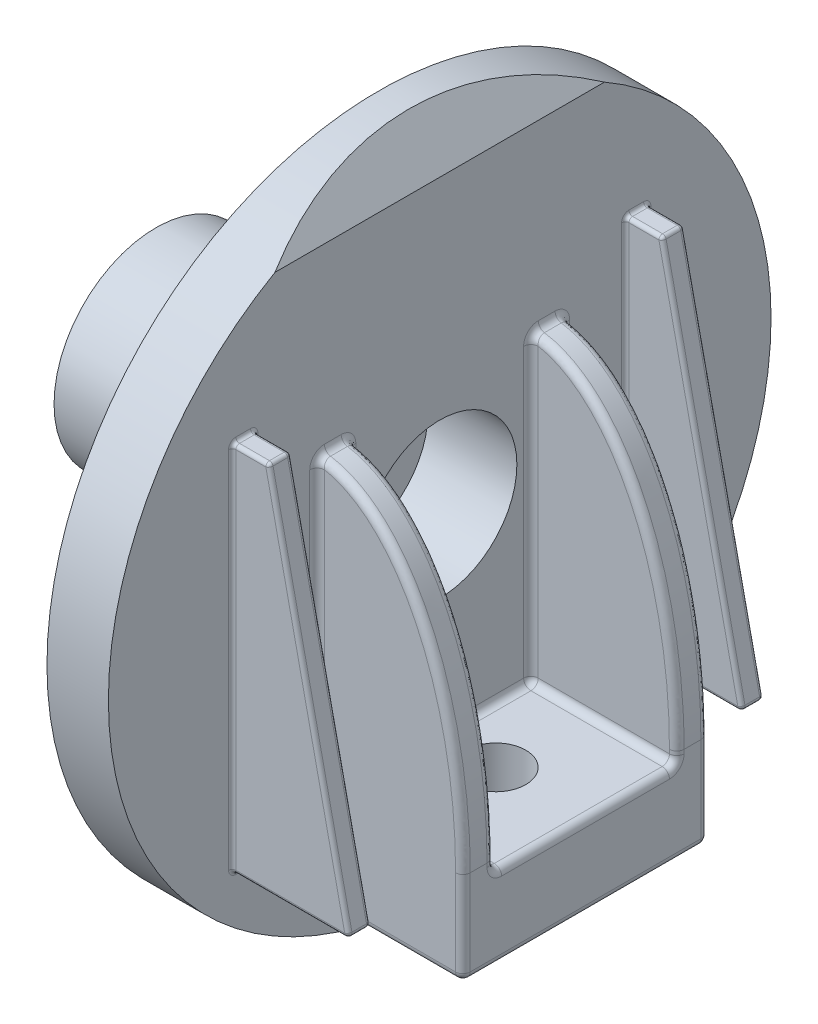
from build123d import *

# Parameters (mm, degrees)
SKETCH1_R               = 22.65
BOSS_EXTRUDE1_DEPTH     = 4.2
SKETCH2_R               = 20.05
CUT_EXTRUDE1_DEPTH      = 2.25
FILLET1_R               = 0.3
SKETCH4_R               = 6.965
BOSS_EXTRUDE3_DEPTH     = 17.45
FILLET2_R               = 1.5
SKETCH5_R               = 4.875
CUT_EXTRUDE3_DEPTH      = 12.26
SKETCH3_R               = 2.625
CUT_EXTRUDE2_DEPTH      = 11.25
SKETCH6_R               = 5.275
CUT_EXTRUDE5_DEPTH      = 6.08
BOSS_EXTRUDE4_START     = 12.26
BOSS_EXTRUDE4_DEPTH     = 12.26
BOSS_EXTRUDE5_DEPTH     = 9.97
FILLET3_START           = -8.385
FILLET3_DEPTH           = 16.77
SKETCH9_R               = 2.045
CUT_EXTRUDE6_DEPTH      = 9.97
FILLET4_R               = 0.5
CUT_EXTRUDE7_DEPTH      = 19.97
CUT_EXTRUDE7_DEPTH_BACK = 19.97
BOSS_EXTRUDE6_START     = 17.63
BOSS_EXTRUDE6_DEPTH     = 17.63
SKETCH12_W              = 1.5
SKETCH12_H              = 25.4
BOSS_EXTRUDE7_DEPTH     = 8
CUT_EXTRUDE8_DEPTH      = 4
FILLET5_R               = 0.25


with BuildPart() as part:
    # Sketch1 → Boss-Extrude1 (new body)
    with BuildSketch(Plane(origin=(0, 0, 0), x_dir=(0, 0, -1), z_dir=(1, 0, 0))):
        Circle(SKETCH1_R)
    extrude(amount=BOSS_EXTRUDE1_DEPTH)

    # Sketch2 → Cut-Extrude1 (cut)
    with BuildSketch(Plane.ZY):
        Circle(SKETCH2_R)
    extrude(amount=-CUT_EXTRUDE1_DEPTH, mode=Mode.SUBTRACT)

    # Fillet1
    fillet1_edges = [part.edges().sort_by_distance(p)[0] for p in [
        (2.25, 0, -20.05),
        (0, 0, -20.05),
    ]]
    fillet(fillet1_edges, radius=FILLET1_R)

    # Sketch4 → Boss-Extrude3 (add)
    with BuildSketch(Plane.ZY.offset(-2.25)):
        Circle(SKETCH4_R)
    extrude(amount=BOSS_EXTRUDE3_DEPTH)

    # Fillet2
    fillet2_edges = [part.edges().sort_by_distance(p)[0] for p in [
        (2.25, 0, -6.965),
    ]]
    fillet(fillet2_edges, radius=FILLET2_R)

    # Sketch5 → Cut-Extrude3 (cut)
    with BuildSketch(Plane.ZY.offset(15.2)):
        Circle(SKETCH5_R)
    extrude(amount=-CUT_EXTRUDE3_DEPTH, mode=Mode.SUBTRACT)

    # Sketch3 → Cut-Extrude2 (cut)
    with BuildSketch(Plane(origin=(4.2, 0, 0), x_dir=(0, 0, -1), z_dir=(1, 0, 0))):
        Circle(SKETCH3_R)
    extrude(amount=-CUT_EXTRUDE2_DEPTH, mode=Mode.SUBTRACT)

    # Sketch6 → Cut-Extrude5 (cut)
    with BuildSketch(Plane(origin=(4.2, 0, 0), x_dir=(0, 0, -1), z_dir=(1, 0, 0))):
        Circle(SKETCH6_R)
    extrude(amount=-CUT_EXTRUDE5_DEPTH, mode=Mode.SUBTRACT)

    # Sketch7 → Boss-Extrude4 (add)
    with BuildSketch(Plane.ZY.offset(2.94).offset(BOSS_EXTRUDE4_START)):
        with BuildLine():
            Line((-2.69098495, -4.065), (2.69098495, -4.065))
            ThreePointArc((2.69098495, -4.065), (0, -4.875), (-2.69098495, -4.065))
        make_face()
        with BuildLine():
            Line((2.69098495, 4.065), (-2.69098495, 4.065))
            ThreePointArc((-2.69098495, 4.065), (0, 4.875), (2.69098495, 4.065))
        make_face()
    extrude(amount=-BOSS_EXTRUDE4_DEPTH)

    # Sketch8 → Boss-Extrude5 (add)
    with BuildSketch(Plane(origin=(4.2, 0, 0), x_dir=(0, 0, -1), z_dir=(1, 0, 0))):
        Polygon((8.385, -18.97), (-8.385, -18.97), (-8.385, 7.34), (-6.235, 7.34), (-6.235, -13.37), (6.235, -13.37), (6.235, 7.34), (8.385, 7.34), align=None)
    extrude(amount=BOSS_EXTRUDE5_DEPTH)

    # Fillet3: read off the stored shape, not the designer's step
    # Fillet3 outline → Fillet3 (cut)
    with BuildSketch(Plane.XY.offset(FILLET3_START)):
        with BuildLine():
            Line((14.17, 7.34), (4.2, 7.34))
            add(Edge.make_bspline(
                [(4.2, 7.34), (14.17, 6.575053386), (14.17, -12.601391626)],
                knots=[0, 0, 0, 1, 1, 1], degree=2, weights=[1, 0.733655232, 1]))
            Line((14.17, -12.601391626), (14.17, 7.34))
        make_face()
    extrude(amount=FILLET3_DEPTH, mode=Mode.SUBTRACT)

    # Sketch9 → Cut-Extrude6 (cut)
    with BuildSketch(Plane.XZ.offset(18.97)):
        with Locations(Location((8.035, 0, 0), (0, 0, 270))):
            Circle(SKETCH9_R)
    extrude(amount=-CUT_EXTRUDE6_DEPTH, mode=Mode.SUBTRACT)

    # Fillet4
    fillet4_edges = [part.edges().sort_by_distance(p)[0] for p in [
        (4.2, 7.34, -7.31),
        (4.2, -18.97, 0),
        (4.2, 7.34, 7.31),
        (9.185, -13.37, 6.235),
        (12.196725877, -0.808020122, 6.235),
        (4.2, -3.015, 6.235),
        (9.185, -13.37, -6.235),
        (4.2, -3.015, -6.235),
        (12.196725877, -0.808020122, -6.235),
        (9.185, -18.97, -8.385),
        (12.196714654, -0.807990396, -8.385),
        (4.2, -5.815, -8.385),
        (9.185, -18.97, 8.385),
        (4.2, -5.815, 8.385),
        (12.196714654, -0.807990396, 8.385),
        (14.17, -18.97, 0),
        (14.17, -15.785695813, 8.385),
        (14.17, -12.985695813, 6.235),
        (14.17, -13.37, 0),
        (14.17, -12.985695813, -6.235),
        (14.17, -15.785695813, -8.385),
        (4.2, -13.37, 0),
    ]]
    fillet(fillet4_edges, radius=FILLET4_R)

    # Sketch10 → Cut-Extrude7 (cut, two sides: drawn at the far end of the back side and taken through both)
    with BuildSketch(Plane.XY.offset(-CUT_EXTRUDE7_DEPTH_BACK)):
        Polygon((4.2, 22.65), (4.2, 19.65), (2.1, 22.65), align=None)
    extrude(amount=CUT_EXTRUDE7_DEPTH + CUT_EXTRUDE7_DEPTH_BACK, mode=Mode.SUBTRACT)

    # Sketch11 → Boss-Extrude6 (add)
    with BuildSketch(Plane.ZY.offset(-2.25).offset(BOSS_EXTRUDE6_START)):
        with BuildLine():
            Line((-13.934449115, -11.746503601), (-15.100463786, -12.729434137))
            ThreePointArc((-15.100463786, -12.729434137), (-17.387088963, -9.367584394), (-18.936856458, -5.608740275))
            Line((-18.936856458, -5.608740275), (-16.97304198, -5.238162459))
            Line((-16.97304198, -5.238162459), (-17.343902907, -3.272847682))
            Line((-17.343902907, -3.272847682), (-22.25718985, -4.2))
            ThreePointArc((-22.25718985, -4.2), (-22.105835396, -4.935032061), (-21.930213837, -5.664646596))
            Line((-21.930213837, -5.664646596), (-22.898435199, -5.914741368))
            ThreePointArc((-22.898435199, -5.914741368), (-22.668143265, -6.743721592), (-22.407850884, -7.563776751))
            Line((-22.407850884, -7.563776751), (-21.460373046, -7.243955324))
            ThreePointArc((-21.460373046, -7.243955324), (-20.279979501, -10.086869258), (-18.725016199, -12.743479444))
            Line((-18.725016199, -12.743479444), (-19.551727731, -13.306105468))
            ThreePointArc((-19.551727731, -13.306105468), (-18.925107529, -14.183187407), (-18.259172679, -15.03080547))
            Line((-18.259172679, -15.03080547), (-17.487114637, -14.395253442))
            ThreePointArc((-17.487114637, -14.395253442), (-16.015968594, -16.015968594), (-14.395253442, -17.487114637))
            Line((-14.395253442, -17.487114637), (-15.03080547, -18.259172679))
            ThreePointArc((-15.03080547, -18.259172679), (-14.183187407, -18.925107529), (-13.306105468, -19.551727731))
            Line((-13.306105468, -19.551727731), (-12.743479444, -18.725016199))
            ThreePointArc((-12.743479444, -18.725016199), (-10.086869258, -20.279979501), (-7.243955324, -21.460373046))
            Line((-7.243955324, -21.460373046), (-7.563776751, -22.407850884))
            ThreePointArc((-7.563776751, -22.407850884), (-6.743721592, -22.668143265), (-5.914741368, -22.898435199))
            Line((-5.914741368, -22.898435199), (-5.664646596, -21.930213837))
            ThreePointArc((-5.664646596, -21.930213837), (-4.935032061, -22.105835396), (-4.2, -22.25718985))
            Line((-4.2, -22.25718985), (-3.272847682, -17.343902907))
            Line((-3.272847682, -17.343902907), (-5.238162459, -16.97304198))
            Line((-5.238162459, -16.97304198), (-5.608740275, -18.936856458))
            ThreePointArc((-5.608740275, -18.936856458), (-9.367584394, -17.387088963), (-12.729434137, -15.100463786))
            Line((-12.729434137, -15.100463786), (-11.746503601, -13.934449115))
            ThreePointArc((-11.746503601, -13.934449115), (-12.886993811, -12.886993811), (-13.934449115, -11.746503601))
        make_face()
    extrude(amount=-BOSS_EXTRUDE6_DEPTH)

    # Sketch12 → Boss-Extrude7 (add)
    with BuildSketch(Plane(origin=(4.2, 0, 0), x_dir=(0, 0, -1), z_dir=(1, 0, 0))):
        with Locations((13.435, -1.712172826)):
            Rectangle(SKETCH12_W, SKETCH12_H)
    boss_extrude7 = extrude(amount=BOSS_EXTRUDE7_DEPTH)

    # Sketch13 → Cut-Extrude8 (cut)
    with BuildSketch(Plane(origin=(0, 0, -14.185), x_dir=(-1, 0, 0), z_dir=(0, 0, -1))):
        Polygon((-6.7, 10.987827174), (-12.2, -14.412172826), (-12.2, 10.987827174), align=None)
    cut_extrude8 = extrude(amount=-CUT_EXTRUDE8_DEPTH, mode=Mode.SUBTRACT)

    # Mirror1: Boss-Extrude7, Cut-Extrude8 across plane
    add(boss_extrude7.mirror(Plane.XY))
    add(cut_extrude8.mirror(Plane.XY), mode=Mode.SUBTRACT)

    # Fillet5
    fillet5_edges = [part.edges().sort_by_distance(p)[0] for p in [
        (4.2, -14.412172826, -13.435),
        (8.2, -14.412172826, -12.685),
        (4.2, -1.712172826, -14.185),
        (8.2, -14.412172826, -14.185),
        (4.2, 10.987827174, -13.435),
        (4.2, -1.712172826, -12.685),
        (12.2, -14.412172826, -13.435),
        (5.45, 10.987827174, -12.685),
        (5.45, 10.987827174, -14.185),
        (9.45, -1.712172826, -12.685),
        (6.7, 10.987827174, -13.435),
        (9.45, -1.712172826, -14.185),
        (12.2, -14.412172826, 13.435),
        (8.2, -14.412172826, 14.185),
        (8.2, -14.412172826, 12.685),
        (4.2, -14.412172826, 13.435),
        (4.2, -1.712172826, 14.185),
        (4.2, 10.987827174, 13.435),
        (4.2, -1.712172826, 12.685),
        (5.45, 10.987827174, 14.185),
        (5.45, 10.987827174, 12.685),
        (6.7, 10.987827174, 13.435),
        (9.45, -1.712172826, 12.685),
        (9.45, -1.712172826, 14.185),
    ]]
    fillet(fillet5_edges, radius=FILLET5_R)


solid = part.part
